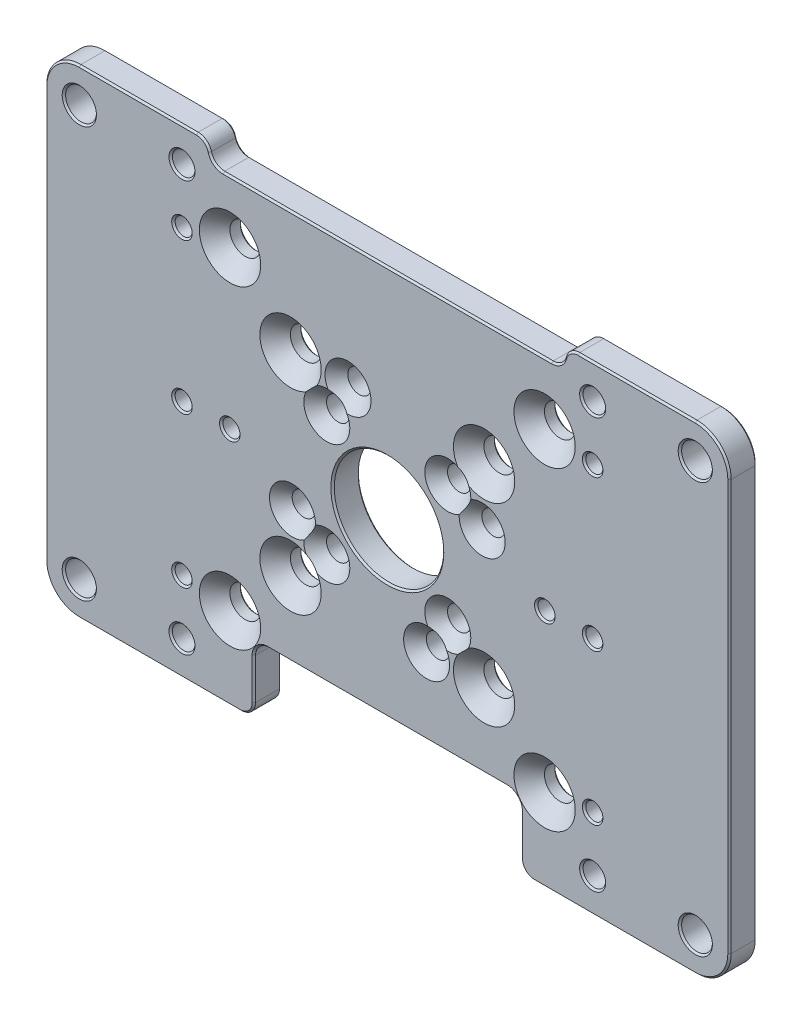
from build123d import *

# Parameters (mm, degrees)
SKETCH1_W                                       = 100
SKETCH1_H                                       = 70
BOSS_EXTRUDE1_DEPTH                             = 4
CUT_EXTRUDE1_DEPTH                              = 62.163714733
CUT_EXTRUDE2_DEPTH                              = 62.163714733
F_2_5_2_5_DIAMETER_HOLE1_D                      = 2.5
F_2_5_2_5_DIAMETER_HOLE2_D                      = 2.5
F_4_5_4_5_DIAMETER_HOLE1_D                      = 4.5
F_4_5_4_5_DIAMETER_HOLE2_D                      = 4.5
F_3_3_3_3_DIAMETER_HOLE1_D                      = 3.3
F_3_3_3_3_DIAMETER_HOLE2_D                      = 3.3
F_16_0_16_DIAMETER_HOLE1_D                      = 16
CSK_FOR_M3_FLAT_HEAD_MACHINE_SCREW1_D           = 3.4
CSK_FOR_M3_FLAT_HEAD_MACHINE_SCREW1_CSINK_D     = 6.72
CSK_FOR_M3_FLAT_HEAD_MACHINE_SCREW1_CSINK_ANGLE = 90
CSK_FOR_M4_FLAT_HEAD_MACHINE_SCREW1_AT_2_COUNT  = 2
CSK_FOR_M4_FLAT_HEAD_MACHINE_SCREW1_AT_2_PITCH  = 12.5
CSK_FOR_M4_FLAT_HEAD_MACHINE_SCREW1_AT_3_COUNT  = 2
CSK_FOR_M4_FLAT_HEAD_MACHINE_SCREW1_AT_3_PITCH  = 28.284271247
CSK_FOR_M4_FLAT_HEAD_MACHINE_SCREW1_AT_4_COUNT  = 2
CSK_FOR_M4_FLAT_HEAD_MACHINE_SCREW1_AT_4_PITCH  = 38.160843806
CSK_FOR_M4_FLAT_HEAD_MACHINE_SCREW1_AT_5_COUNT  = 2
CSK_FOR_M4_FLAT_HEAD_MACHINE_SCREW1_AT_5_PITCH  = 40
CSK_FOR_M4_FLAT_HEAD_MACHINE_SCREW1_AT_6_COUNT  = 2
CSK_FOR_M4_FLAT_HEAD_MACHINE_SCREW1_AT_6_PITCH  = 52.5
CSK_FOR_M4_FLAT_HEAD_MACHINE_SCREW1_AT_7_COUNT  = 2
CSK_FOR_M4_FLAT_HEAD_MACHINE_SCREW1_AT_7_PITCH  = 28.284271247
CSK_FOR_M4_FLAT_HEAD_MACHINE_SCREW1_AT_8_COUNT  = 2
CSK_FOR_M4_FLAT_HEAD_MACHINE_SCREW1_AT_8_PITCH  = 38.160843806
FILLET1_R                                       = 2
FILLET2_R                                       = 5
CHAMFER1_SIZE                                   = 0.25


with BuildPart() as part:
    # Sketch1 → Boss-Extrude1 (new body)
    with BuildSketch(Plane.XY):
        Rectangle(SKETCH1_W, SKETCH1_H)
    extrude(amount=-BOSS_EXTRUDE1_DEPTH)

    # Sketch2 → Cut-Extrude1 (cut, through all)
    with BuildSketch(Plane(origin=(0, 0, -4), x_dir=(-1, 0, 0), z_dir=(0, 0, -1))):
        with BuildLine():
            Line((27.872983346, 35), (-27.872983346, 35))
            ThreePointArc((-27.872983346, 35), (-26.648238475, 34.58113883), (-25.936491673, 33.5))
            ThreePointArc((-25.936491673, 33.5), (-25.224744871, 32.41886117), (-24, 32))
            Line((-24, 32), (24, 32))
            ThreePointArc((24, 32), (25.224744871, 32.41886117), (25.936491673, 33.5))
            ThreePointArc((25.936491673, 33.5), (26.648238475, 34.58113883), (27.872983346, 35))
        make_face()
    extrude(amount=-CUT_EXTRUDE1_DEPTH, mode=Mode.SUBTRACT)

    # Sketch3 → Cut-Extrude2 (cut, through all)
    with BuildSketch(Plane(origin=(0, 0, -4), x_dir=(-1, 0, 0), z_dir=(0, 0, -1))):
        with BuildLine():
            Line((-19.5, -35), (19.5, -35))
            Line((19.5, -35), (19.5, -27))
            ThreePointArc((19.5, -27), (18.914213562, -25.585786438), (17.5, -25))
            Line((17.5, -25), (-17.5, -25))
            ThreePointArc((-17.5, -25), (-18.914213562, -25.585786438), (-19.5, -27))
            Line((-19.5, -27), (-19.5, -35))
        make_face()
    extrude(amount=-CUT_EXTRUDE2_DEPTH, mode=Mode.SUBTRACT)

    # Ø2.5 (2.5) Diameter Hole1 (through all)
    with Locations(Plane(origin=(0, 0, -4), x_dir=(-1, 0, 0), z_dir=(0, 0, -1))):
        with Locations((-30, 22)):
            Hole(F_2_5_2_5_DIAMETER_HOLE1_D / 2)

    # Ø2.5 (2.5) Diameter Hole2 (through all)
    with Locations(Plane.XY):
        with Locations((23.0125, 0), (-23.0125, 0), (-30, 22), (30, 0), (30, -22), (-30, -22), (-30, 0)):
            Hole(F_2_5_2_5_DIAMETER_HOLE2_D / 2)

    # Ø4.5 (4.5) Diameter Hole1 (through all)
    with Locations(Plane.XY):
        with Locations((-45, 30), (45, -30)):
            Hole(F_4_5_4_5_DIAMETER_HOLE1_D / 2)

    # Ø4.5 (4.5) Diameter Hole2 (through all)
    with Locations(Plane(origin=(0, 0, -4), x_dir=(-1, 0, 0), z_dir=(0, 0, -1))):
        with Locations((45, -30), (-45, 30)):
            Hole(F_4_5_4_5_DIAMETER_HOLE2_D / 2)

    # Ø3.3 (3.3) Diameter Hole1 (through all)
    with Locations(Plane(origin=(0, 0, -4), x_dir=(-1, 0, 0), z_dir=(0, 0, -1))):
        with Locations((-30, -30)):
            Hole(F_3_3_3_3_DIAMETER_HOLE1_D / 2)

    # Ø3.3 (3.3) Diameter Hole2 (through all)
    with Locations(Plane.XY):
        with Locations((-30, 30), (-30, -30), (30, 30)):
            Hole(F_3_3_3_3_DIAMETER_HOLE2_D / 2)

    # Ø16.0 (16) Diameter Hole1 (through all)
    with Locations(Plane.XY):
        with Locations((0, 0)):
            Hole(F_16_0_16_DIAMETER_HOLE1_D / 2)

    # CSK for M3 Flat Head Machine Screw1 (through all)
    with Locations(Plane.XY):
        with Locations((-8.838834765, -8.838834765), (-13.858192988, -5.740251485), (-8.838834765, 8.838834765), (-5.740251485, 13.858192988), (8.838834765, 8.838834765), (13.858192988, 5.740251485), (8.838834765, -8.838834765), (5.740251485, -13.858192988)):
            CounterSinkHole(CSK_FOR_M3_FLAT_HEAD_MACHINE_SCREW1_D / 2, CSK_FOR_M3_FLAT_HEAD_MACHINE_SCREW1_CSINK_D / 2, counter_sink_angle=CSK_FOR_M3_FLAT_HEAD_MACHINE_SCREW1_CSINK_ANGLE)

    # Sketch20 → CSK for M4 Flat Head Machine Screw1 (revolve, cut)
    with BuildSketch(Plane(origin=(-14.142135624, -14.142135624, 0), x_dir=(0, -1, 0), z_dir=(1, 0, 0))):
        Polygon((0, 0), (0, 4), (2.25, 4), (2.25, 2.23), (4.48, 0), align=None)
    csk_for_m4_flat_head_machine_screw1 = revolve(axis=Axis((-14.142135624, -14.142135624, 6.35), (0, 0, -1)), mode=Mode.SUBTRACT)

    # CSK for M4 Flat Head Machine Screw1 at 2: CSK for M4 Flat Head Machine Screw1 ×2
    with Locations(*[Vector(-0.7071067811865483, -0.7071067811865468, 0) * (i * CSK_FOR_M4_FLAT_HEAD_MACHINE_SCREW1_AT_2_PITCH) for i in range(1, CSK_FOR_M4_FLAT_HEAD_MACHINE_SCREW1_AT_2_COUNT)]):
        add(csk_for_m4_flat_head_machine_screw1, mode=Mode.SUBTRACT)

    # CSK for M4 Flat Head Machine Screw1 at 3: CSK for M4 Flat Head Machine Screw1 ×2
    with Locations(*[(0, i * CSK_FOR_M4_FLAT_HEAD_MACHINE_SCREW1_AT_3_PITCH, 0) for i in range(1, CSK_FOR_M4_FLAT_HEAD_MACHINE_SCREW1_AT_3_COUNT)]):
        add(csk_for_m4_flat_head_machine_screw1, mode=Mode.SUBTRACT)

    # CSK for M4 Flat Head Machine Screw1 at 4: CSK for M4 Flat Head Machine Screw1 ×2
    with Locations(*[Vector(-0.23162052730604002, 0.9728062146853669, 0) * (i * CSK_FOR_M4_FLAT_HEAD_MACHINE_SCREW1_AT_4_PITCH) for i in range(1, CSK_FOR_M4_FLAT_HEAD_MACHINE_SCREW1_AT_4_COUNT)]):
        add(csk_for_m4_flat_head_machine_screw1, mode=Mode.SUBTRACT)

    # CSK for M4 Flat Head Machine Screw1 at 5: CSK for M4 Flat Head Machine Screw1 ×2
    with Locations(*[Vector(0.707106781186547, 0.707106781186548, 0) * (i * CSK_FOR_M4_FLAT_HEAD_MACHINE_SCREW1_AT_5_PITCH) for i in range(1, CSK_FOR_M4_FLAT_HEAD_MACHINE_SCREW1_AT_5_COUNT)]):
        add(csk_for_m4_flat_head_machine_screw1, mode=Mode.SUBTRACT)

    # CSK for M4 Flat Head Machine Screw1 at 6: CSK for M4 Flat Head Machine Screw1 ×2
    with Locations(*[Vector(0.7071067811865474, 0.7071067811865477, 0) * (i * CSK_FOR_M4_FLAT_HEAD_MACHINE_SCREW1_AT_6_PITCH) for i in range(1, CSK_FOR_M4_FLAT_HEAD_MACHINE_SCREW1_AT_6_COUNT)]):
        add(csk_for_m4_flat_head_machine_screw1, mode=Mode.SUBTRACT)

    # CSK for M4 Flat Head Machine Screw1 at 7: CSK for M4 Flat Head Machine Screw1 ×2
    with Locations(*[(i * CSK_FOR_M4_FLAT_HEAD_MACHINE_SCREW1_AT_7_PITCH, 0, 0) for i in range(1, CSK_FOR_M4_FLAT_HEAD_MACHINE_SCREW1_AT_7_COUNT)]):
        add(csk_for_m4_flat_head_machine_screw1, mode=Mode.SUBTRACT)

    # CSK for M4 Flat Head Machine Screw1 at 8: CSK for M4 Flat Head Machine Screw1 ×2
    with Locations(*[Vector(0.9728062146853669, -0.23162052730603966, 0) * (i * CSK_FOR_M4_FLAT_HEAD_MACHINE_SCREW1_AT_8_PITCH) for i in range(1, CSK_FOR_M4_FLAT_HEAD_MACHINE_SCREW1_AT_8_COUNT)]):
        add(csk_for_m4_flat_head_machine_screw1, mode=Mode.SUBTRACT)

    # Fillet1
    fillet1_edges = [part.edges().sort_by_distance(p)[0] for p in [
        (19.5, -35, -2),
        (-19.5, -35, -2),
    ]]
    fillet(fillet1_edges, radius=FILLET1_R)

    # Fillet2
    fillet2_edges = [part.edges().sort_by_distance(p)[0] for p in [
        (50, 35, -2),
        (50, -35, -2),
        (-50, 35, -2),
        (-50, -35, -2),
    ]]
    fillet(fillet2_edges, radius=FILLET2_R)

    # Chamfer1
    chamfer1_edges = [part.edges().sort_by_distance(p)[0] for p in [
        (31.25, -22, -4),
        (-12.158192988, -5.740251485, -4),
        (50, 0, 0),
        (48.535533906, -33.535533906, 0),
        (48.535533906, 33.535533906, 0),
        (33.25, -35, 0),
        (36.436491673, 35, 0),
        (20.085786438, -34.414213562, 0),
        (26.648238475, 34.58113883, 0),
        (19.5, -30, 0),
        (25.224744871, 32.41886117, 0),
        (18.914213562, -25.585786438, 0),
        (0, 32, 0),
        (0, -25, 0),
        (-25.224744871, 32.41886117, 0),
        (-18.914213562, -25.585786438, 0),
        (-26.648238475, 34.58113883, 0),
        (-19.5, -30, 0),
        (-36.436491673, 35, 0),
        (-20.085786438, -34.414213562, 0),
        (-48.535533906, 33.535533906, 0),
        (-33.25, -35, 0),
        (-50, 0, 0),
        (-48.535533906, -33.535533906, 0),
        (-33.25, -35, -4),
        (-48.535533906, -33.535533906, -4),
        (-20.085786438, -34.414213562, -4),
        (-50, 0, -4),
        (-19.5, -30, -4),
        (-48.535533906, 33.535533906, -4),
        (-18.914213562, -25.585786438, -4),
        (-36.436491673, 35, -4),
        (0, -25, -4),
        (-26.648238475, 34.58113883, -4),
        (18.914213562, -25.585786438, -4),
        (-25.224744871, 32.41886117, -4),
        (19.5, -30, -4),
        (0, 32, -4),
        (20.085786438, -34.414213562, -4),
        (25.224744871, 32.41886117, -4),
        (33.25, -35, -4),
        (26.648238475, 34.58113883, -4),
        (48.535533906, -33.535533906, -4),
        (36.436491673, 35, -4),
        (50, 0, -4),
        (48.535533906, 33.535533906, -4),
        (-42.75, 30, -4),
        (15.558192988, 5.740251485, -4),
        (24.2625, 0, -4),
        (-28.35, -30, -4),
        (-4.040251485, 13.858192988, -4),
        (7.440251485, -13.858192988, -4),
        (31.25, 0, -4),
        (-28.75, 0, -4),
        (47.25, -30, -4),
        (31.65, 30, -4),
        (-14.142135624, -11.892135624, -4),
        (-14.142135624, 16.392135624, -4),
        (14.142135624, 16.392135624, -4),
        (14.142135624, -11.892135624, -4),
        (8, 0, -4),
        (8, 0, 0),
        (47.25, -30, 0),
        (42.75, 30, 0),
        (31.65, 30, 0),
        (28.75, 22, 0),
        (24.2625, 0, 0),
        (31.25, 0, 0),
        (31.25, -22, 0),
        (28.75, 22, -4),
        (28.35, -30, 0),
        (-28.75, -22, -4),
        (-47.25, -30, 0),
        (-28.75, 22, -4),
        (-28.35, -30, 0),
        (-21.7625, 0, -4),
        (-28.75, -22, 0),
        (42.75, 30, -4),
        (-21.7625, 0, 0),
        (-47.25, -30, -4),
        (-28.75, 0, 0),
        (28.35, -30, -4),
        (-28.75, 22, 0),
        (-28.35, 30, -4),
        (-28.35, 30, 0),
        (-22.980970389, -20.730970389, -4),
        (-42.75, 30, 0),
        (-7.138834765, -8.838834765, -4),
        (-22.980970389, 25.230970389, -4),
        (-7.138834765, 8.838834765, -4),
        (22.980970389, 25.230970389, -4),
        (10.538834765, 8.838834765, -4),
        (22.980970389, -20.730970389, -4),
        (10.538834765, -8.838834765, -4),
    ]]
    chamfer(chamfer1_edges, length=CHAMFER1_SIZE)


solid = part.part
